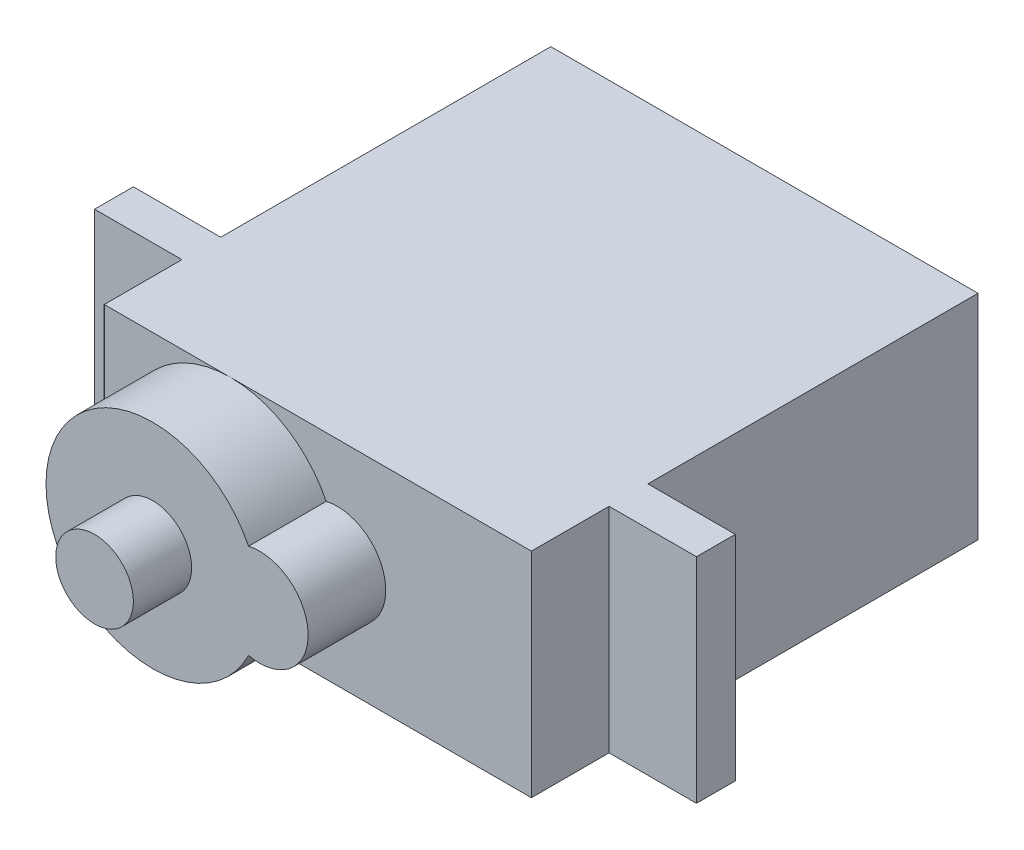
from build123d import *

# Parameters (mm, degrees)
SKETCH2_W           = 31
SKETCH2_H           = 11
SKETCH2_R           = 2
BOSS_EXTRUDE1_DEPTH = 23
SKETCH2_2_R         = 2
BOSS_EXTRUDE2_DEPTH = 30
SKETCH3_W           = 4.5
SKETCH3_H           = 11
CUT_EXTRUDE1_DEPTH  = 4
CUT_EXTRUDE2_START  = -6
SKETCH3_5_W         = 4.5
SKETCH3_5_H         = 11
CUT_EXTRUDE2_DEPTH  = 23.275431031
BOSS_EXTRUDE3_DEPTH = 4


with BuildPart() as part:
    # Sketch2 → Boss-Extrude1 (new body)
    with BuildSketch(Plane.XY):
        Rectangle(SKETCH2_W, SKETCH2_H)
        with Locations((-4.5, 0)):
            Circle(SKETCH2_R, mode=Mode.SUBTRACT)
    extrude(amount=BOSS_EXTRUDE1_DEPTH)

    # Sketch2<2> → Boss-Extrude2 (add)
    with BuildSketch(Plane.XY):
        with Locations((-4.5, 0)):
            Circle(SKETCH2_2_R)
    extrude(amount=BOSS_EXTRUDE2_DEPTH)

    # Sketch3 → Cut-Extrude1 (cut)
    with BuildSketch(Plane.XY.offset(23)):
        with Locations((-13.25, 0)):
            Rectangle(SKETCH3_W, SKETCH3_H)
        with Locations((13.25, 0)):
            Rectangle(SKETCH3_W, SKETCH3_H)
    extrude(amount=-CUT_EXTRUDE1_DEPTH, mode=Mode.SUBTRACT)

    # Sketch3<5> → Cut-Extrude2 (cut, through all)
    with BuildSketch(Plane.XY.offset(23).offset(CUT_EXTRUDE2_START)):
        with Locations((-13.25, 0)):
            Rectangle(SKETCH3_5_W, SKETCH3_5_H)
        with Locations((13.25, 0)):
            Rectangle(SKETCH3_5_W, SKETCH3_5_H)
    extrude(amount=-CUT_EXTRUDE2_DEPTH, mode=Mode.SUBTRACT)

    # Sketch4 → Boss-Extrude3 (add)
    with BuildSketch(Plane.XY.offset(23)):
        with BuildLine():
            ThreePointArc((0.431818182, 2.434577873), (-10, 0), (0.431818182, -2.434577873))
            ThreePointArc((0.431818182, -2.434577873), (3.5, 0), (0.431818182, 2.434577873))
        make_face()
    extrude(amount=BOSS_EXTRUDE3_DEPTH)


solid = part.part
